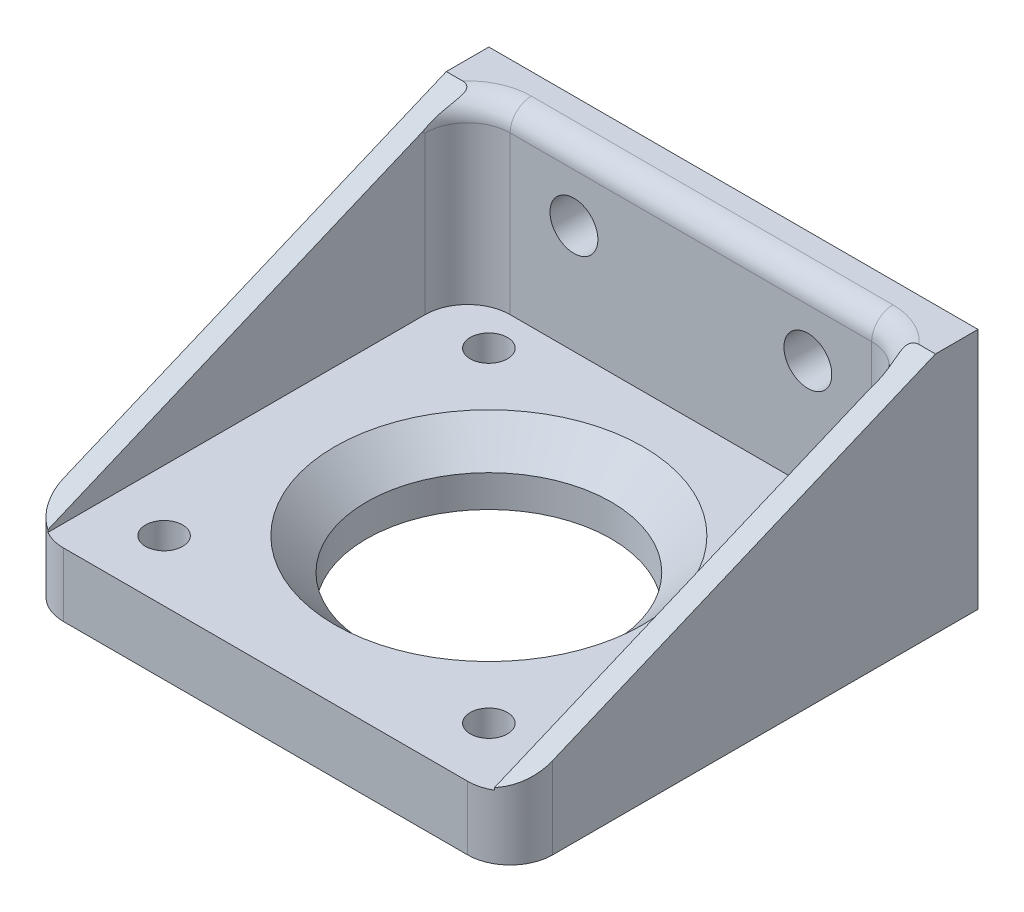
from build123d import *

# Parameters (mm, degrees)
BOSS_EXTRUDE1_START = -3
SKETCH1_W           = 46
SKETCH1_H           = 44
SKETCH1_R           = 11.5
BOSS_EXTRUDE1_DEPTH = 6
SKETCH3_W           = 46
SKETCH3_H           = 4
BOSS_EXTRUDE2_DEPTH = 16.8
BOSS_EXTRUDE3_DEPTH = 2
BOSS_EXTRUDE4_START = -46
BOSS_EXTRUDE4_DEPTH = 2
SKETCH5_R           = 1.75
CUT_EXTRUDE1_DEPTH  = 42.856535929
SKETCH6_R           = 2.25
CUT_EXTRUDE2_DEPTH  = 55.341880718
FILLET1_R           = 4
FILLET2_START       = -19.0000001
FILLET2_2_DEPTH     = 34.0000001
CHAMFER1_SIZE       = 3


with BuildPart() as part:
    # Sketch1 → Boss-Extrude1 (new body)
    with BuildSketch(Plane(origin=(0, 0, 0), x_dir=(1, 0, 0), z_dir=(0, 1, 0)).offset(BOSS_EXTRUDE1_START)):
        with Locations((-2, -2.64)):
            Rectangle(SKETCH1_W, SKETCH1_H)
        with Locations(Location((-2, -3.64, 0), (0, 0, 270))):
            Circle(SKETCH1_R, mode=Mode.SUBTRACT)
    extrude(amount=BOSS_EXTRUDE1_DEPTH)

    # Sketch3 → Boss-Extrude2 (add)
    with BuildSketch(Plane(origin=(0, 3, 0), x_dir=(1, 0, 0), z_dir=(0, 1, 0))):
        with Locations((-2, 17.36)):
            Rectangle(SKETCH3_W, SKETCH3_H)
    extrude(amount=BOSS_EXTRUDE2_DEPTH)

    # Sketch4 → Boss-Extrude3 (add)
    with BuildSketch(Plane.ZY.offset(25)):
        Polygon((-15.36, 19.8), (-15.36, 3), (24.64, 3), align=None)
    extrude(amount=-BOSS_EXTRUDE3_DEPTH)

    # Sketch4<2> → Boss-Extrude4 (add)
    with BuildSketch(Plane.ZY.offset(25).offset(BOSS_EXTRUDE4_START)):
        Polygon((-15.36, 19.8), (-15.36, 3), (24.64, 3), align=None)
    extrude(amount=BOSS_EXTRUDE4_DEPTH)

    # Sketch5 → Cut-Extrude1 (cut, through all)
    with BuildSketch(Plane.XZ.offset(3)):
        with Locations(Location((-17.273506474, 18.913506474, 0), (0, 0, 270))):
            Circle(SKETCH5_R)
        with Locations(Location((13.273506474, 18.913506474, 0), (0, 0, 270))):
            Circle(SKETCH5_R)
        with Locations(Location((13.273506474, -11.633506474, 0), (0, 0, 270))):
            Circle(SKETCH5_R)
        with Locations(Location((-17.273506474, -11.633506474, 0), (0, 0, 270))):
            Circle(SKETCH5_R)
    extrude(amount=-CUT_EXTRUDE1_DEPTH, mode=Mode.SUBTRACT)

    # Sketch6 → Cut-Extrude2 (cut, through all)
    with BuildSketch(Plane(origin=(0, 0, -19.36), x_dir=(-1, 0, 0), z_dir=(0, 0, -1))):
        with Locations((-9, 13.23890477)):
            Circle(SKETCH6_R)
        with Locations((13, 13.23890477)):
            Circle(SKETCH6_R)
    extrude(amount=-CUT_EXTRUDE2_DEPTH, mode=Mode.SUBTRACT)

    # Fillet1
    # the kernel refuses this fillet: 4 mm, written as the material it adds along each edge
    with BuildSketch(Plane(origin=(-23, 29.8, -15.36), x_dir=(0, 0, 1), z_dir=(0, -1, 0))) as fillet1_piece_1_section:
        with BuildLine():
            CenterArc((FILLET1_R, -FILLET1_R), FILLET1_R, 90, 90)
            Line((0, -FILLET1_R), (0, 0))
            Line((0, 0), (FILLET1_R, 0))
        make_face()
    fillet1_piece_1 = extrude(amount=26.8, mode=Mode.PRIVATE)
    fillet1_piece_1 = split(fillet1_piece_1, bisect_by=Plane(origin=(-23, 21.299489969, -18.930214213), z_dir=(0, -0.9219821056073614, -0.3872324843550918)), keep=Keep.TOP, mode=Mode.PRIVATE)
    add(fillet1_piece_1)
    with BuildSketch(Plane(origin=(19, 29.8, -15.36), x_dir=(0, 0, 1), z_dir=(0, -1, 0))) as fillet1_piece_2_section:
        with BuildLine():
            CenterArc((FILLET1_R, FILLET1_R), FILLET1_R, 180, 90)
            Line((0, FILLET1_R), (0, 0))
            Line((0, 0), (FILLET1_R, 0))
        make_face()
    fillet1_piece_2 = extrude(amount=26.8, mode=Mode.PRIVATE)
    fillet1_piece_2 = split(fillet1_piece_2, bisect_by=Plane(origin=(19, 21.299489969, -18.930214213), z_dir=(0, -0.9219821056073614, -0.3872324843550918)), keep=Keep.TOP, mode=Mode.PRIVATE)
    add(fillet1_piece_2)
    # the kernel refuses this fillet: 4 mm, written as the material it takes off along each edge
    with BuildSketch(Plane(origin=(21, -13, 24.64), x_dir=(-1, 0, 0), z_dir=(0, 1, 0))) as fillet1_2_piece_1:
        with BuildLine():
            CenterArc((FILLET1_R, -FILLET1_R), FILLET1_R, 90, 90)
            Line((0, -FILLET1_R), (0, 0))
            Line((0, 0), (FILLET1_R, 0))
        make_face()
    extrude(amount=26, mode=Mode.SUBTRACT)
    with BuildSketch(Plane(origin=(-25, -13, 24.64), x_dir=(1, 0, 0), z_dir=(0, 1, 0))) as fillet1_2_piece_2:
        with BuildLine():
            CenterArc((FILLET1_R, FILLET1_R), FILLET1_R, 180, 90)
            Line((0, FILLET1_R), (0, 0))
            Line((0, 0), (FILLET1_R, 0))
        make_face()
    extrude(amount=26, mode=Mode.SUBTRACT)

    # Fillet2: read off the stored shape, not the designer's step
    # Fillet2 outline → Fillet2 (revolve, cut)
    with BuildSketch(Plane(origin=(15, 0, -11.36), x_dir=(1, 0, 0), z_dir=(0, 0, 1))):
        with BuildLine():
            ThreePointArc((4, 17.8), (4.585786438, 19.214213562), (6, 19.8))
            Line((6, 19.8), (4, 19.8))
            Line((4, 19.8), (4, 17.8))
        make_face()
    revolve(axis=Axis((15, 0, -11.36), (0, 1, 0)), mode=Mode.SUBTRACT)

    # Fillet2 2 outline → Fillet2 2 (cut)
    with BuildSketch(Plane.YZ.offset(FILLET2_START)):
        with BuildLine():
            Line((19.8, -15.36), (17.8, -15.36))
            ThreePointArc((17.8, -15.36), (19.214213562, -15.945786438), (19.8, -17.36))
            Line((19.8, -17.36), (19.8, -15.36))
        make_face()
    extrude(amount=FILLET2_2_DEPTH, mode=Mode.SUBTRACT)

    # Fillet2 3 outline → Fillet2 3 (revolve, cut)
    with BuildSketch(Plane(origin=(-19, 0, -11.36), x_dir=(1, 0, 0), z_dir=(0, 0, 1))):
        with BuildLine():
            ThreePointArc((4, 17.8), (4.585786438, 19.214213562), (6, 19.8))
            Line((6, 19.8), (4, 19.8))
            Line((4, 19.8), (4, 17.8))
        make_face()
    revolve(axis=Axis((-19, 0, -11.36), (0, 1, 0)), mode=Mode.SUBTRACT)

    # Chamfer1
    chamfer1_edges = [part.edges().sort_by_distance(p)[0] for p in [
        (-2, 3, -7.86),
    ]]
    chamfer(chamfer1_edges, length=CHAMFER1_SIZE)


solid = part.part
